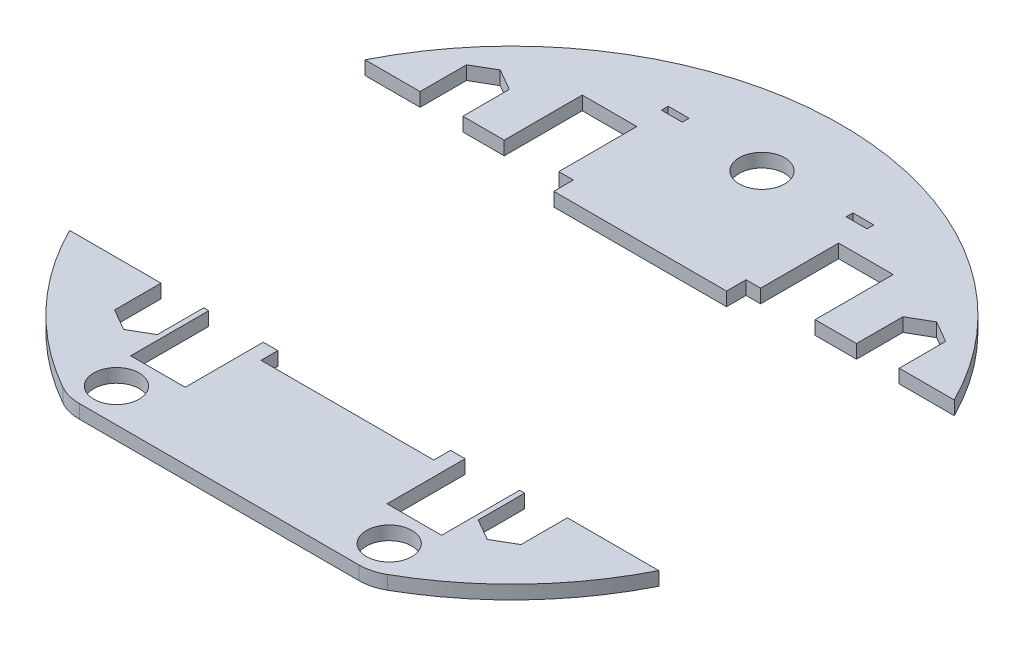
from build123d import *

# Parameters (mm, degrees)
BOSS_EXTRUDE1_DEPTH = 3
CUT_EXTRUDE1_DEPTH  = 103.574363269
SKETCH3_W           = 38.3
SKETCH3_H           = 65
CUT_EXTRUDE2_DEPTH  = 103.574363269
SKETCH4_R           = 5
CUT_EXTRUDE3_DEPTH  = 98.289516393
CUT_EXTRUDE4_DEPTH  = 98.289516393
SKETCH6_W           = 4.6
SKETCH6_H           = 1.5
CUT_EXTRUDE5_DEPTH  = 98.289516393
SKETCH7_R           = 5
CUT_EXTRUDE6_DEPTH  = 98.289516393


with BuildPart() as part:
    # Sketch1 → Boss-Extrude1 (new body)
    with BuildSketch(Plane(origin=(0, 0, 0), x_dir=(1, 0, 0), z_dir=(0, 1, 0))):
        with BuildLine():
            Line((-30.763446914, -64.404598464), (30.763446914, -64.404598464))
            ThreePointArc((30.763446914, -64.404598464), (33.308308644, -64.075362589), (35.68559842, -63.109334218))
            ThreePointArc((35.68559842, -63.109334218), (0, 72.5), (-35.68559842, -63.109334218))
            ThreePointArc((-35.68559842, -63.109334218), (-33.308308644, -64.075362589), (-30.763446914, -64.404598464))
        make_face()
    extrude(amount=BOSS_EXTRUDE1_DEPTH)

    # Sketch2 → Cut-Extrude1 (cut, through all)
    with BuildSketch(Plane(origin=(0, 3, 0), x_dir=(1, 0, 0), z_dir=(0, 1, 0))):
        Polygon((-34.2, 49.675685802), (-34.2, -49.675685802), (-22.2, -49.675685802), (-22.2, -32.5), (-19, -32.5), (-19, -36.2), (-18, -36.2), (18, -36.2), (19, -36.2), (19, -32.5), (22.2, -32.5), (22.2, -49.675685802), (34.2, -49.675685802), (34.2, 49.675685802), (22.2, 49.675685802), (22.2, 32.5), (19, 32.5), (19, 28.2), (-19, 28.2), (-19, 32.5), (-22.2, 32.5), (-22.2, 49.675685802), align=None)
    extrude(amount=-CUT_EXTRUDE1_DEPTH, mode=Mode.SUBTRACT)

    # Sketch3 → Cut-Extrude2 (cut, through all)
    with BuildSketch(Plane(origin=(0, 3, 0), x_dir=(1, 0, 0), z_dir=(0, 1, 0))):
        with Locations((-53.35, 0)):
            Rectangle(SKETCH3_W, SKETCH3_H)
        with Locations((53.35, 0)):
            Rectangle(SKETCH3_W, SKETCH3_H)
    extrude(amount=-CUT_EXTRUDE2_DEPTH, mode=Mode.SUBTRACT)


with BuildPart() as cut_extrude2_piece_1:
    # of the separate pieces the step leaves, piece 1, a body of its own (cut_extrude2_pieces)
    add(part.part.solids().sort_by_distance((64.807406984, 0, -32.5))[0])


with BuildPart() as cut_extrude2_piece_2:
    # of the separate pieces the step leaves, piece 2, a body of its own (cut_extrude2_pieces)
    add(part.part.solids().sort_by_distance((-35.68559842, 0, 63.109334218))[0])

    # Sketch4 → Cut-Extrude3 (cut, through all)
    with BuildSketch(Plane(origin=(0, 3, 0), x_dir=(1, 0, 0), z_dir=(0, 1, 0))):
        with Locations((30, -57)):
            Circle(SKETCH4_R)
        with Locations((-30, -57)):
            Circle(SKETCH4_R)
    extrude(amount=-CUT_EXTRUDE3_DEPTH, mode=Mode.SUBTRACT)


with BuildPart() as cut_extrude4_tool:
    # Sketch5 → Cut-Extrude4 (new, through all)
    with BuildSketch(Plane(origin=(0, 3, 0), x_dir=(1, 0, 0), z_dir=(0, 1, 0))):
        Polygon((-52.7, 37.286453735), (-52.7, 32.5), (-43.3, 32.5), (-43.3, 37.286453735), (-43.3, 42.713546265), (-48, 45.42709253), (-52.7, 42.713546265), align=None)
        Polygon((-44.7, -37.286453735), (-44.7, -32.5), (-35.3, -32.5), (-35.3, -37.286453735), (-35.3, -42.713546265), (-40, -45.42709253), (-44.7, -42.713546265), align=None)
        Polygon((35.3, -32.5), (44.7, -32.5), (44.7, -37.286453735), (44.7, -42.713546265), (40, -45.42709253), (35.3, -42.713546265), (35.3, -37.286453735), align=None)
        Polygon((43.3, 37.286453735), (43.3, 42.713546265), (48, 45.42709253), (52.7, 42.713546265), (52.7, 37.286453735), (52.7, 32.5), (43.3, 32.5), align=None)
    extrude(amount=-CUT_EXTRUDE4_DEPTH)


with BuildPart() as cut_extrude2_piece_1_1:
    add(cut_extrude2_piece_1.part)

    # Cut-Extrude4: cut by cut_extrude4_tool
    add(cut_extrude4_tool.part, mode=Mode.SUBTRACT)

    # Sketch6 → Cut-Extrude5 (cut, through all)
    with BuildSketch(Plane(origin=(0, 3, 0), x_dir=(1, 0, 0), z_dir=(0, 1, 0))):
        with Locations((-20.32, 56.25)):
            Rectangle(SKETCH6_W, SKETCH6_H)
        with Locations((20.32, 56.25)):
            Rectangle(SKETCH6_W, SKETCH6_H)
    extrude(amount=-CUT_EXTRUDE5_DEPTH, mode=Mode.SUBTRACT)

    # Sketch7 → Cut-Extrude6 (cut, through all)
    with BuildSketch(Plane(origin=(0, 3, 0), x_dir=(1, 0, 0), z_dir=(0, 1, 0))):
        with Locations((0, 55)):
            Circle(SKETCH7_R)
    extrude(amount=-CUT_EXTRUDE6_DEPTH, mode=Mode.SUBTRACT)


with BuildPart() as cut_extrude2_piece_2_1:
    add(cut_extrude2_piece_2.part)

    # Cut-Extrude4: cut by cut_extrude4_tool
    add(cut_extrude4_tool.part, mode=Mode.SUBTRACT)


solid = Compound([cut_extrude2_piece_1_1.part, cut_extrude2_piece_2_1.part])
